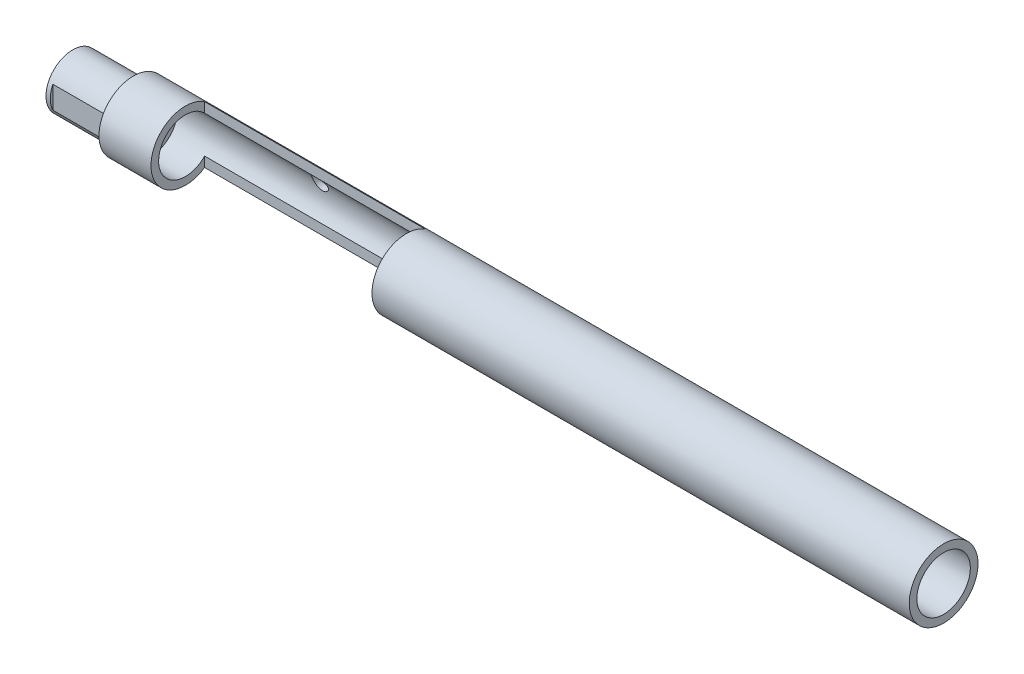
from build123d import *

# Parameters (mm, degrees)
SKETCH2_R                       = 3.96875
SKETCH2_R_2                     = 3.0861
BODY_DEPTH                      = 100
SCREW_HOLE_FOR_WHEEL_DEPTH      = 101.157386
SCREW_HOLE_FOR_WHEEL_DEPTH_BACK = 101.157386
SKETCH3_R                       = 0.5
NOSE_START                      = 12
SKETCH5_R                       = 3.96875
NOSE_DEPTH                      = 12
CHAMFER1_SIZE                   = 1
SKETCH10_R                      = 2.4
CUT_EXTRUDE3_DEPTH              = 113.140546
CAVITY_FOR_WHEEL_DEPTH          = 101.157386
CAVITY_FOR_WHEEL_DEPTH_BACK     = 101.157386
SKETCH4_W                       = 25.5
SKETCH4_H                       = 13.71875
F_2_56_TAPPED_HOLE2_D           = 1.778
CUT_EXTRUDE5_DEPTH              = 10
CUT_EXTRUDE5_DEPTH_BACK         = 10
SKETCH17_R                      = 1.1303
CUT_EXTRUDE4_DEPTH              = 10
CUT_EXTRUDE4_DEPTH_BACK         = 10
SKETCH16_W                      = 30.682561
SKETCH16_H                      = 17.27639
BOSS_EXTRUDE1_DEPTH             = 7
BOSS_EXTRUDE1_DEPTH_BACK        = 2
SKETCH18_R                      = 3.0861
SKETCH18_R_2                    = 2.0861
SKETCH20_W                      = 2.127384
SKETCH20_H                      = 7.889241
SKETCH20_W_2                    = 2.358385
SKETCH20_H_2                    = 10.122376
CUT_EXTRUDE6_DEPTH              = 6.5


with BuildPart() as part:
    # Sketch2 → Body (new body)
    with BuildSketch(Plane(origin=(0, 0, 0), x_dir=(0, 0, -1), z_dir=(1, 0, 0))):
        Circle(SKETCH2_R)
        Circle(SKETCH2_R_2, mode=Mode.SUBTRACT)
    extrude(amount=BODY_DEPTH)

    # Sketch3 → Screw hole for wheel (cut, two sides: drawn at the far end of the back side and taken through both)
    with BuildSketch(Plane.XY.offset(-SCREW_HOLE_FOR_WHEEL_DEPTH_BACK)):
        with Locations((25.25, 1.238647)):
            Circle(SKETCH3_R)
    extrude(amount=SCREW_HOLE_FOR_WHEEL_DEPTH + SCREW_HOLE_FOR_WHEEL_DEPTH_BACK, mode=Mode.SUBTRACT)

    # Sketch5 → Nose (add)
    with BuildSketch(Plane.ZY.offset(NOSE_START)):
        Circle(SKETCH5_R)
    extrude(amount=-NOSE_DEPTH)

    # Chamfer1
    chamfer1_edges = [part.edges().sort_by_distance(p)[0] for p in [
        (-12, 0, -3.96875),
    ]]
    chamfer(chamfer1_edges, length=CHAMFER1_SIZE)

    # Sketch10 → Cut-Extrude3 (cut, through all)
    with BuildSketch(Plane.ZY.offset(12)):
        Circle(SKETCH10_R)
    extrude(amount=-CUT_EXTRUDE3_DEPTH, mode=Mode.SUBTRACT)

    # Cut-Sweep1: sweep along a curve in space
    with BuildLine() as cut_sweep1_path:
        add(Edge.make_bspline(
            [(-12, 0, -3.96875), (-11.970813, 0.516187, -3.96875), (-11.911788, 1.559824, -3.762105), (-11.823773, 2.878986, -2.87939), (-11.735619, 3.762213, -1.558315), (-11.647502, 4.072044, 0), (-11.559375, 3.762112, 1.558315), (-11.47125, 2.879388, 2.87939), (-11.383125, 1.558315, 3.762105), (-11.295, 0, 4.072073), (-11.206875, -1.558315, 3.762105), (-11.11875, -2.87939, 2.87939), (-11.030625, -3.762105, 1.558315), (-10.9425, -4.072073, 0), (-10.854375, -3.762105, -1.558315), (-10.76625, -2.87939, -2.87939), (-10.678125, -1.558315, -3.762105), (-10.59, 0, -4.072073), (-10.501875, 1.558315, -3.762105), (-10.41375, 2.87939, -2.87939), (-10.325625, 3.762105, -1.558315), (-10.2375, 4.072073, 0), (-10.149375, 3.762105, 1.558315), (-10.06125, 2.87939, 2.87939), (-9.973125, 1.558315, 3.762105), (-9.885, 0, 4.072073), (-9.796875, -1.558315, 3.762105), (-9.70875, -2.87939, 2.87939), (-9.620625, -3.762105, 1.558315), (-9.5325, -4.072073, 0), (-9.444375, -3.762105, -1.558315), (-9.35625, -2.87939, -2.87939), (-9.268125, -1.558315, -3.762105), (-9.18, 0, -4.072073), (-9.091875, 1.558315, -3.762105), (-9.00375, 2.87939, -2.87939), (-8.915625, 3.762105, -1.558315), (-8.8275, 4.072073, 0), (-8.739375, 3.762105, 1.558315), (-8.65125, 2.87939, 2.87939), (-8.563125, 1.558315, 3.762105), (-8.475, 0, 4.072073), (-8.386875, -1.558315, 3.762105), (-8.29875, -2.87939, 2.87939), (-8.210625, -3.762105, 1.558315), (-8.1225, -4.072073, 0), (-8.034375, -3.762105, -1.558315), (-7.94625, -2.87939, -2.87939), (-7.858125, -1.558315, -3.762105), (-7.77, 0, -4.072073), (-7.681875, 1.558315, -3.762105), (-7.59375, 2.87939, -2.87939), (-7.505625, 3.762105, -1.558315), (-7.4175, 4.072073, 0), (-7.329375, 3.762105, 1.558315), (-7.24125, 2.87939, 2.87939), (-7.153125, 1.558315, 3.762105), (-7.065, 0, 4.072073), (-6.976875, -1.558315, 3.762105), (-6.88875, -2.87939, 2.87939), (-6.800625, -3.762105, 1.558315), (-6.7125, -4.072073, 0), (-6.624375, -3.762105, -1.558315), (-6.53625, -2.87939, -2.87939), (-6.448125, -1.558315, -3.762105), (-6.36, 0, -4.072073), (-6.271875, 1.558315, -3.762105), (-6.18375, 2.87939, -2.87939), (-6.095625, 3.762105, -1.558315), (-6.0075, 4.072073, 0), (-5.919375, 3.762105, 1.558315), (-5.83125, 2.87939, 2.87939), (-5.743125, 1.558315, 3.762105), (-5.655, 0, 4.072073), (-5.566875, -1.558315, 3.762105), (-5.47875, -2.87939, 2.87939), (-5.390625, -3.762105, 1.558315), (-5.3025, -4.072073, 0), (-5.214375, -3.762105, -1.558315), (-5.12625, -2.87939, -2.87939), (-5.038125, -1.558315, -3.762105), (-4.95, 0, -4.072073), (-4.861875, 1.558315, -3.762105), (-4.77375, 2.87939, -2.87939), (-4.685625, 3.762105, -1.558315), (-4.5975, 4.072073, 0), (-4.509375, 3.762105, 1.558315), (-4.42125, 2.87939, 2.87939), (-4.333125, 1.558315, 3.762105), (-4.245, 0, 4.072073), (-4.156875, -1.558315, 3.762105), (-4.06875, -2.87939, 2.87939), (-3.980625, -3.762105, 1.558315), (-3.8925, -4.072073, 0), (-3.804375, -3.762105, -1.558315), (-3.71625, -2.87939, -2.87939), (-3.628125, -1.558315, -3.762105), (-3.54, 0, -4.072073), (-3.451875, 1.558315, -3.762105), (-3.36375, 2.87939, -2.87939), (-3.275625, 3.762105, -1.558315), (-3.1875, 4.072073, 0), (-3.099375, 3.762105, 1.558315), (-3.01125, 2.87939, 2.87939), (-2.923125, 1.558315, 3.762105), (-2.835, 0, 4.072073), (-2.746875, -1.558315, 3.762105), (-2.65875, -2.87939, 2.87939), (-2.570625, -3.762105, 1.558315), (-2.4825, -4.072073, 0), (-2.394375, -3.762105, -1.558315), (-2.30625, -2.87939, -2.87939), (-2.218125, -1.558315, -3.762105), (-2.13, 0, -4.072073), (-2.041875, 1.558315, -3.762105), (-1.95375, 2.87939, -2.87939), (-1.865625, 3.762105, -1.558315), (-1.7775, 4.072073, 0), (-1.689375, 3.762105, 1.558315), (-1.60125, 2.87939, 2.87939), (-1.513125, 1.558315, 3.762105), (-1.425, 0, 4.072073), (-1.336875, -1.558315, 3.762105), (-1.24875, -2.87939, 2.87939), (-1.160625, -3.762105, 1.558315), (-1.0725, -4.072073, 0), (-0.984375, -3.762105, -1.558315), (-0.89625, -2.87939, -2.87939), (-0.808125, -1.558315, -3.762105), (-0.72, 0, -4.072073), (-0.631875, 1.558315, -3.762105), (-0.54375, 2.879388, -2.87939), (-0.455625, 3.762112, -1.558315), (-0.367498, 4.072044, 0), (-0.279381, 3.762213, 1.558315), (-0.191227, 2.878986, 2.87939), (-0.103212, 1.559824, 3.762105), (-0.044187, 0.516187, 3.96875), (-0.015, 0, 3.96875)],
            knots=[0, 0, 0, 0, 0.007353, 0.014706, 0.022059, 0.029412, 0.036765, 0.044118, 0.051471, 0.058824, 0.066176, 0.073529, 0.080882, 0.088235, 0.095588, 0.102941, 0.110294, 0.117647, 0.125, 0.132353, 0.139706, 0.147059, 0.154412, 0.161765, 0.169118, 0.176471, 0.183824, 0.191176, 0.198529, 0.205882, 0.213235, 0.220588, 0.227941, 0.235294, 0.242647, 0.25, 0.257353, 0.264706, 0.272059, 0.279412, 0.286765, 0.294118, 0.301471, 0.308824, 0.316176, 0.323529, 0.330882, 0.338235, 0.345588, 0.352941, 0.360294, 0.367647, 0.375, 0.382353, 0.389706, 0.397059, 0.404412, 0.411765, 0.419118, 0.426471, 0.433824, 0.441176, 0.448529, 0.455882, 0.463235, 0.470588, 0.477941, 0.485294, 0.492647, 0.5, 0.507353, 0.514706, 0.522059, 0.529412, 0.536765, 0.544118, 0.551471, 0.558824, 0.566176, 0.573529, 0.580882, 0.588235, 0.595588, 0.602941, 0.610294, 0.617647, 0.625, 0.632353, 0.639706, 0.647059, 0.654412, 0.661765, 0.669118, 0.676471, 0.683824, 0.691176, 0.698529, 0.705882, 0.713235, 0.720588, 0.727941, 0.735294, 0.742647, 0.75, 0.757353, 0.764706, 0.772059, 0.779412, 0.786765, 0.794118, 0.801471, 0.808824, 0.816176, 0.823529, 0.830882, 0.838235, 0.845588, 0.852941, 0.860294, 0.867647, 0.875, 0.882353, 0.889706, 0.897059, 0.904412, 0.911765, 0.919118, 0.926471, 0.933824, 0.941176, 0.948529, 0.955882, 0.963235, 0.970588, 0.977941, 0.985294, 0.992647, 1, 1, 1, 1], degree=3))
    with BuildLine() as cut_sweep1_axis:
        Line((-12, 0, 0), (-0.015, 0, 0))
    # Sketch7 → Cut-Sweep1 (sweep, cut)
    with BuildSketch(Plane.XY):
        Polygon((-12, -3.96875), (-12.09, -3.96875), (-12.53, -3.1), (-12.71, -3.1), (-12.71, -5.224109), (-11.29, -5.224109), (-11.29, -3.1), (-11.47, -3.1), (-11.91, -3.96875), align=None)
    sweep(path=cut_sweep1_path.line, binormal=cut_sweep1_axis.edges()[0], mode=Mode.SUBTRACT)

    # Sketch4 → cavity for wheel (cut, two sides: drawn at the far end of the back side and taken through both)
    with BuildSketch(Plane(origin=(0, 0, 0), x_dir=(1, 0, 0), z_dir=(0, 1, 0)).offset(-CAVITY_FOR_WHEEL_DEPTH_BACK)):
        with Locations((25.25, -4.640625)):
            Rectangle(SKETCH4_W, SKETCH4_H)
    extrude(amount=CAVITY_FOR_WHEEL_DEPTH + CAVITY_FOR_WHEEL_DEPTH_BACK, mode=Mode.SUBTRACT)

    # #2-56 Tapped Hole2 (through all)
    with Locations(Plane.XY.offset(-2.21875)):
        with Locations((25.25, 1.238647)):
            Hole(F_2_56_TAPPED_HOLE2_D / 2)

    # Sketch17 → Cut-Extrude5 (cut, two sides: drawn at the far end of the back side and taken through both)
    with BuildSketch(Plane.XY.offset(-CUT_EXTRUDE5_DEPTH_BACK)):
        with Locations((3, 0)):
            Circle(SKETCH17_R)
    extrude(amount=CUT_EXTRUDE5_DEPTH + CUT_EXTRUDE5_DEPTH_BACK, mode=Mode.SUBTRACT)

    # Sketch16 → Cut-Extrude4 (cut, two sides: drawn at the far end of the back side and taken through both)
    with BuildSketch(Plane.XY.offset(-CUT_EXTRUDE4_DEPTH_BACK)):
        with Locations((-8.84128, 0.232091)):
            Rectangle(SKETCH16_W, SKETCH16_H)
    extrude(amount=CUT_EXTRUDE4_DEPTH + CUT_EXTRUDE4_DEPTH_BACK, mode=Mode.SUBTRACT)

    # Sketch18 → Boss-Extrude1 (add, two sides: drawn at the far end of the back side and taken through both)
    with BuildSketch(Plane.ZY.offset(-6.5).offset(-BOSS_EXTRUDE1_DEPTH_BACK)):
        with Locations(Location((0, 0, 0), (0, 0, 270))):
            Circle(SKETCH18_R)
        with Locations(Location((0, 0, 0), (0, 0, 270))):
            Circle(SKETCH18_R_2, mode=Mode.SUBTRACT)
    extrude(amount=BOSS_EXTRUDE1_DEPTH + BOSS_EXTRUDE1_DEPTH_BACK)

    # Sketch20 → Cut-Extrude6 (cut)
    with BuildSketch(Plane(origin=(0, 0, 0), x_dir=(0, 0, -1), z_dir=(1, 0, 0))):
        with Locations((3.863692, -0.275293)):
            Rectangle(SKETCH20_W, SKETCH20_H)
        with Locations((-3.979192, -0.378477)):
            Rectangle(SKETCH20_W_2, SKETCH20_H_2)
    extrude(amount=CUT_EXTRUDE6_DEPTH, mode=Mode.SUBTRACT)


solid = part.part
